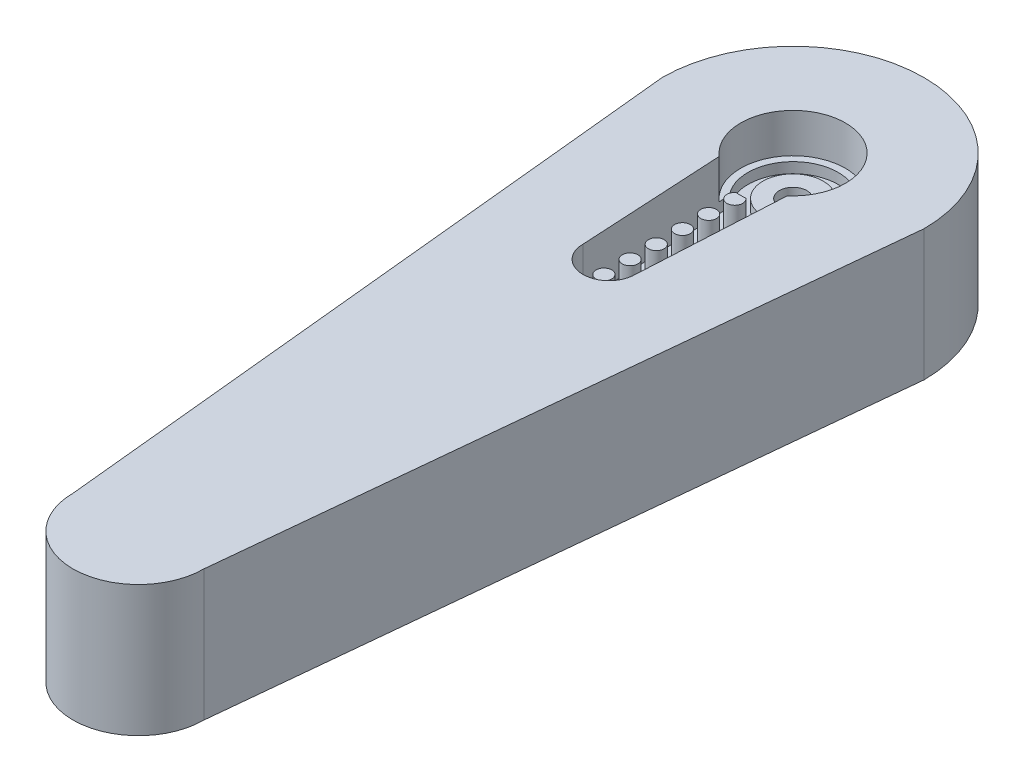
from build123d import *

# Parameters (mm, degrees)
BOSS_EXTRUDE1_DEPTH = 10
CUT_EXTRUDE1_DEPTH  = 3.8
SKETCH6_R           = 2.3
BOSS_EXTRUDE2_DEPTH = 1
SKETCH7_R           = 1.05
CUT_EXTRUDE2_DEPTH  = 57.699667466
SKETCH8_R           = 0.6
BOSS_EXTRUDE3_DEPTH = 3
SKETCH9_R           = 2
CUT_EXTRUDE4_DEPTH  = 6
SKETCH10_R          = 3.99955369
CUT_EXTRUDE7_DEPTH  = 3
CUT_EXTRUDE8_DEPTH  = 58.122782589
SKETCH15_R          = 5
BOSS_EXTRUDE4_DEPTH = 10


# Read off the part's stored shape, not the designer's step: Boss-Extrude1
with BuildPart() as part:
    # Boss-Extrude1 outline → Boss-Extrude1 (new body)
    with BuildSketch(Plane(origin=(0, 0, 0), x_dir=(1, 0, 0), z_dir=(0, 1, 0))):
        with BuildLine():
            Line((5, -55.344368806), (5, -50))
            Line((5, -50), (10, 0))
            ThreePointArc((10, 0), (0, 10), (-10, 0))
            Line((-10, 0), (-5, -50))
            Line((-5, -50), (-10.000656588, -52.844368806))
            Line((-10.000656588, -52.844368806), (-10.000656588, -55.344368806))
            Line((-10.000656588, -55.344368806), (5, -55.344368806))
        make_face()
    extrude(amount=BOSS_EXTRUDE1_DEPTH)

    # Sketch5 → Cut-Extrude1 (cut)
    with BuildSketch(Plane(origin=(0, 10, 0), x_dir=(1, 0, 0), z_dir=(0, 1, 0))):
        with BuildLine():
            Line((2, -14.05), (2.649226302, -2.21))
            ThreePointArc((2.649226302, -2.21), (0, 3.45), (-2.649226302, -2.21))
            Line((-2.649226302, -2.21), (-2, -14.05))
            ThreePointArc((-2, -14.05), (0, -16.05), (2, -14.05))
        make_face()
    extrude(amount=-CUT_EXTRUDE1_DEPTH, mode=Mode.SUBTRACT)

    # Sketch6 → Boss-Extrude2 (add)
    with BuildSketch(Plane(origin=(0, 6.2, 0), x_dir=(1, 0, 0), z_dir=(0, 1, 0))):
        with Locations(Location((0, 0, 0), (0, 0, 270))):
            Circle(SKETCH6_R)
    extrude(amount=BOSS_EXTRUDE2_DEPTH)

    # Sketch7 → Cut-Extrude2 (cut, through all)
    with BuildSketch(Plane(origin=(0, 7.2, 0), x_dir=(1, 0, 0), z_dir=(0, 1, 0))):
        with Locations(Location((0, 0, 0), (0, 0, 270))):
            Circle(SKETCH7_R)
    extrude(amount=-CUT_EXTRUDE2_DEPTH, mode=Mode.SUBTRACT)

    # Sketch8 → Boss-Extrude3 (add)
    with BuildSketch(Plane(origin=(0, 6.2, 0), x_dir=(1, 0, 0), z_dir=(0, 1, 0))):
        with Locations(Location((0, -4.45, 0), (0, 0, 270))):
            Circle(SKETCH8_R)
        with Locations(Location((0, -6.45, 0), (0, 0, 270))):
            Circle(SKETCH8_R)
        with Locations(Location((0, -8.45, 0), (0, 0, 270))):
            Circle(SKETCH8_R)
        with Locations(Location((0, -10.45, 0), (0, 0, 270))):
            Circle(SKETCH8_R)
        with Locations(Location((0, -12.45, 0), (0, 0, 270))):
            Circle(SKETCH8_R)
        with Locations(Location((0, -14.45, 0), (0, 0, 270))):
            Circle(SKETCH8_R)
    extrude(amount=BOSS_EXTRUDE3_DEPTH)

    # Sketch9 → Cut-Extrude4 (cut)
    with BuildSketch(Plane.XZ):
        with Locations(Location((0, 0, 0), (0, 0, 270))):
            Circle(SKETCH9_R)
    extrude(amount=-CUT_EXTRUDE4_DEPTH, mode=Mode.SUBTRACT)

    # Sketch10 → Cut-Extrude7 (cut)
    with BuildSketch(Plane(origin=(0, 10, 0), x_dir=(1, 0, 0), z_dir=(0, 1, 0))):
        Circle(SKETCH10_R)
    extrude(amount=-CUT_EXTRUDE7_DEPTH, mode=Mode.SUBTRACT)

    # Sketch14 → Cut-Extrude8 (cut, through all)
    with BuildSketch(Plane(origin=(0, 10, 0), x_dir=(1, 0, 0), z_dir=(0, 1, 0))):
        Polygon((-5, -50), (5, -50), (5, -55.344368806), (-10.000656588, -55.344368806), (-10.000656588, -52.844368806), align=None)
    extrude(amount=-CUT_EXTRUDE8_DEPTH, mode=Mode.SUBTRACT)

    # Sketch15 → Boss-Extrude4 (add)
    with BuildSketch(Plane(origin=(0, 10, 0), x_dir=(1, 0, 0), z_dir=(0, 1, 0))):
        with Locations((0, -50)):
            Circle(SKETCH15_R)
    extrude(amount=-BOSS_EXTRUDE4_DEPTH)


solid = part.part
